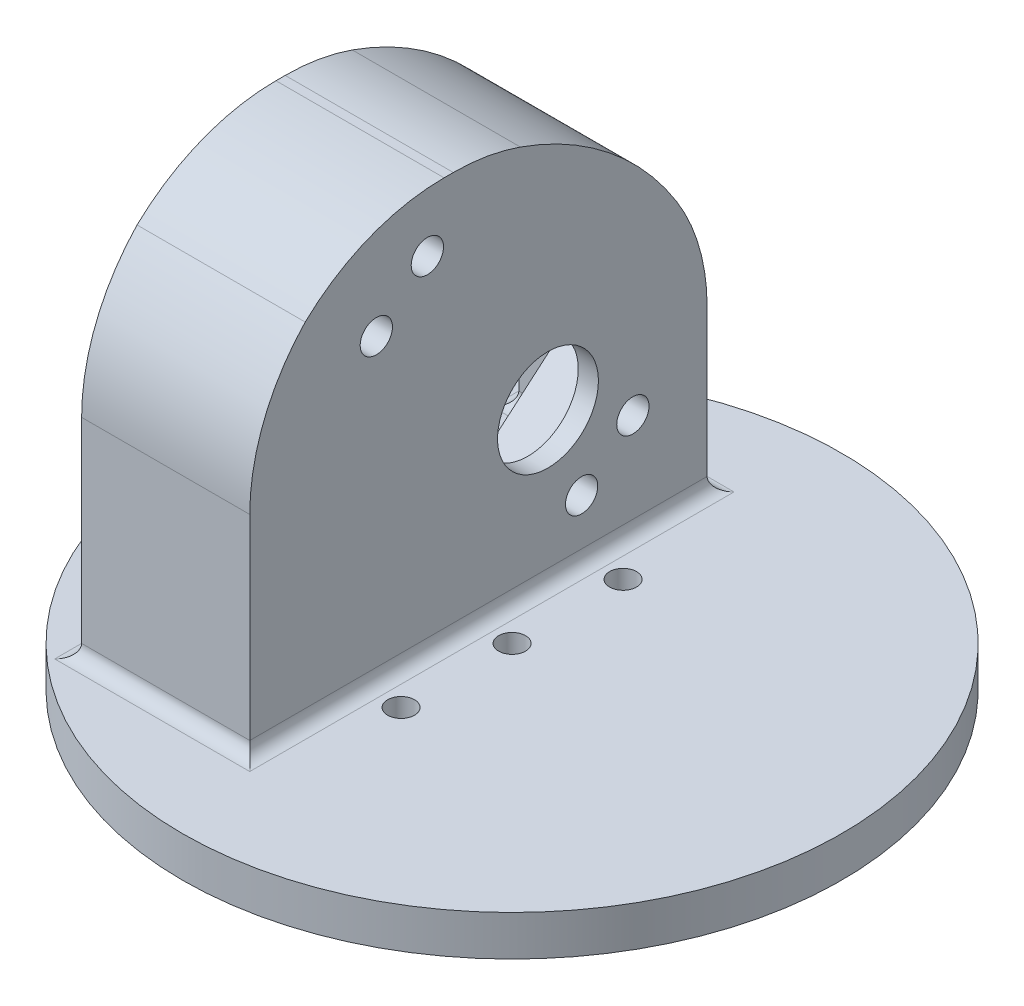
from build123d import *

# Parameters (mm, degrees)
SKETCH1_R           = 49
SKETCH1_R_2         = 2
BOSS_EXTRUDE1_DEPTH = 6
SKETCH3_W           = 25
SKETCH3_H           = 68
BOSS_EXTRUDE2_DEPTH = 60
CUT_EXTRUDE1_DEPTH  = 14
SKETCH5_R           = 2.4
CUT_EXTRUDE2_DEPTH  = 20
CUT_EXTRUDE3_DEPTH  = 30
CUT_EXTRUDE5_DEPTH  = 10
SKETCH13_R          = 7.5
BOSS_EXTRUDE3_DEPTH = 3
FILLET2_R           = 30
FILLET3_R           = 2
FILLET4_R           = 4


with BuildPart() as part:
    # Sketch1 → Boss-Extrude1 (new body)
    with BuildSketch(Plane(origin=(0, 0, 0), x_dir=(1, 0, 0), z_dir=(0, 1, 0))):
        with Locations(Location((0, 0, 0), (0, 0, 270))):
            Circle(SKETCH1_R)
        with Locations(Location((0, 16.5, 0), (0, 0, 270))):
            Circle(SKETCH1_R_2, mode=Mode.SUBTRACT)
        with Locations(Location((0, -16.5, 0), (0, 0, 270))):
            Circle(SKETCH1_R_2, mode=Mode.SUBTRACT)
        with Locations(Location((0, 0, 0), (0, 0, 270))):
            Circle(SKETCH1_R_2, mode=Mode.SUBTRACT)
    extrude(amount=BOSS_EXTRUDE1_DEPTH)

    # Sketch3 → Boss-Extrude2 (add)
    with BuildSketch(Plane(origin=(0, 6, 0), x_dir=(1, 0, 0), z_dir=(0, 1, 0))):
        with Locations((-17.5, 0)):
            Rectangle(SKETCH3_W, SKETCH3_H)
    extrude(amount=BOSS_EXTRUDE2_DEPTH)

    # Sketch4 → Cut-Extrude1 (cut)
    with BuildSketch(Plane.ZY.offset(30)):
        Polygon((-13.82509047, 9), (-29, 22.02774427), (6.17490953, 63), (21.349819059, 49.97225573), align=None)
    extrude(amount=-CUT_EXTRUDE1_DEPTH, mode=Mode.SUBTRACT)

    # Sketch5 → Cut-Extrude2 (cut)
    with BuildSketch(Plane.ZY.offset(16)):
        with Locations((-22.960549625, 21.386659614)):
            Circle(SKETCH5_R)
        with Locations((-15.33906677, 14.912634661)):
            Circle(SKETCH5_R)
        with Locations((7.595246131, 57.167755541)):
            Circle(SKETCH5_R)
        with Locations((15.182700896, 50.653883406)):
            Circle(SKETCH5_R)
        Polygon((-24.440289505, 27.338962606), (-9.265379976, 14.311218335), (16.790108565, 44.661037394), (1.615199035, 57.688781665), align=None)
    extrude(amount=-CUT_EXTRUDE2_DEPTH, mode=Mode.SUBTRACT)

    # Sketch8 → Cut-Extrude3 (cut)
    with BuildSketch(Plane.ZY.offset(30)):
        with BuildLine():
            Line((-34, 36), (-34, 66))
            Line((-34, 66), (0, 66))
            ThreePointArc((0, 66), (-21.05469299, 55.595318722), (-34, 36))
        make_face()
        with BuildLine():
            Line((14.5, 66), (34, 66))
            Line((34, 66), (34, 46.5))
            ThreePointArc((34, 46.5), (25.780574394, 57.780574394), (14.5, 66))
        make_face()
    extrude(amount=-CUT_EXTRUDE3_DEPTH, mode=Mode.SUBTRACT)

    # Sketch12 → Cut-Extrude5 (cut)
    with BuildSketch(Plane.ZY.offset(30)):
        with BuildLine():
            Line((-31, 6), (-31, 36))
            ThreePointArc((-31, 36), (-18.763387337, 53.246852127), (0, 63))
            Line((0, 63), (14.5, 63))
            ThreePointArc((14.5, 63), (23.838103281, 55.838103281), (31, 46.5))
            Line((31, 46.5), (31, 6))
            Line((31, 6), (-31, 6))
        make_face()
    extrude(amount=-CUT_EXTRUDE5_DEPTH, mode=Mode.SUBTRACT)

    # Sketch13 → Boss-Extrude3 (add)
    with BuildSketch(Plane(origin=(-5, 0, 0), x_dir=(0, 0, -1), z_dir=(1, 0, 0))):
        Polygon((-1.615199035, 57.688781665), (-16.790108565, 44.661037394), (9.265379976, 14.311218335), (24.440289505, 27.338962606), align=None)
        with Locations((10.338962606, 28.412545235)):
            Circle(SKETCH13_R, mode=Mode.SUBTRACT)
    extrude(amount=-BOSS_EXTRUDE3_DEPTH)

    # Fillet2
    # the kernel refuses this fillet: 30 mm, written as the material it takes off along each edge
    with BuildSketch(Plane(origin=(-70.677664467, 46.5, 34), x_dir=(0, -1, 0), z_dir=(1, 0, 0))) as fillet2_piece_1:
        with BuildLine():
            CenterArc((9.394104212, 30), FILLET2_R, 222.011677285, 47.988322715)
            ThreePointArc((-12.896148883, 9.921538481), (-6.900227571, 4.373054534), (0, 0))
            Line((0, 0), (9.394104212, 0))
        make_face()
    extrude(amount=106.355328934, mode=Mode.SUBTRACT)
    with BuildSketch(Plane(origin=(-70.677664467, 66, 14.5), x_dir=(0, -0.6097657406745188, 0.7925816938963802), z_dir=(1, 0, 0))) as fillet2_piece_2:
        with BuildLine():
            CenterArc((10.847377191, 29.50565373), FILLET2_R, 232.427433582, 47.988322715)
            Line((-7.445595029, 5.728202913), (0, 0))
            ThreePointArc((0, 0), (8.135532893, -0.741519405), (16.271065787, 0))
        make_face()
    extrude(amount=106.355328934, mode=Mode.SUBTRACT)
    with BuildSketch(Plane(origin=(-46.165023977, 66, 0), x_dir=(0, 0, 1), z_dir=(1, 0, 0))) as fillet2_piece_3:
        with BuildLine():
            CenterArc((3.733152378, 30), FILLET2_R, 250.589019729, 19.410980271)
            ThreePointArc((-6.237104224, 1.705230461), (-3.149219616, 0.740444809), (0, 0))
            Line((0, 0), (3.733152378, 0))
        make_face()
    extrude(amount=57.330047955, mode=Mode.SUBTRACT)
    with BuildSketch(Plane(origin=(-56.823799316, 36, -34), x_dir=(0, -1, 0), z_dir=(1, 0, 0))) as fillet2_piece_4:
        with BuildLine():
            CenterArc((6.194691102, -30), FILLET2_R, 90, 32.01758898)
            ThreePointArc((-9.710696233, -4.563438642), (-4.991844582, -1.99126385), (0, 0))
            Line((0, 0), (6.194691102, 0))
        make_face()
    extrude(amount=78.647598632, mode=Mode.SUBTRACT)

    # Fillet3
    fillet3_edges = [part.edges().sort_by_distance(p)[0] for p in [
        (-30, 6, 32.5),
        (-20, 6, 0),
        (-25, 6, 31),
        (-25, 6, -31),
        (-30, 6, -32.5),
        (-17.5, 6, 34),
        (-5, 6, 0),
        (-17.5, 6, -34),
    ]]
    fillet(fillet3_edges, radius=FILLET3_R)

    # Fillet4
    fillet4_edges = [part.edges().sort_by_distance(p)[0] for p in [
        (-25, 36, -31),
        (-25, 63, 0),
        (-25, 63, 14.5),
        (-25, 46.5, 31),
    ]]
    fillet(fillet4_edges, radius=FILLET4_R)


solid = part.part
